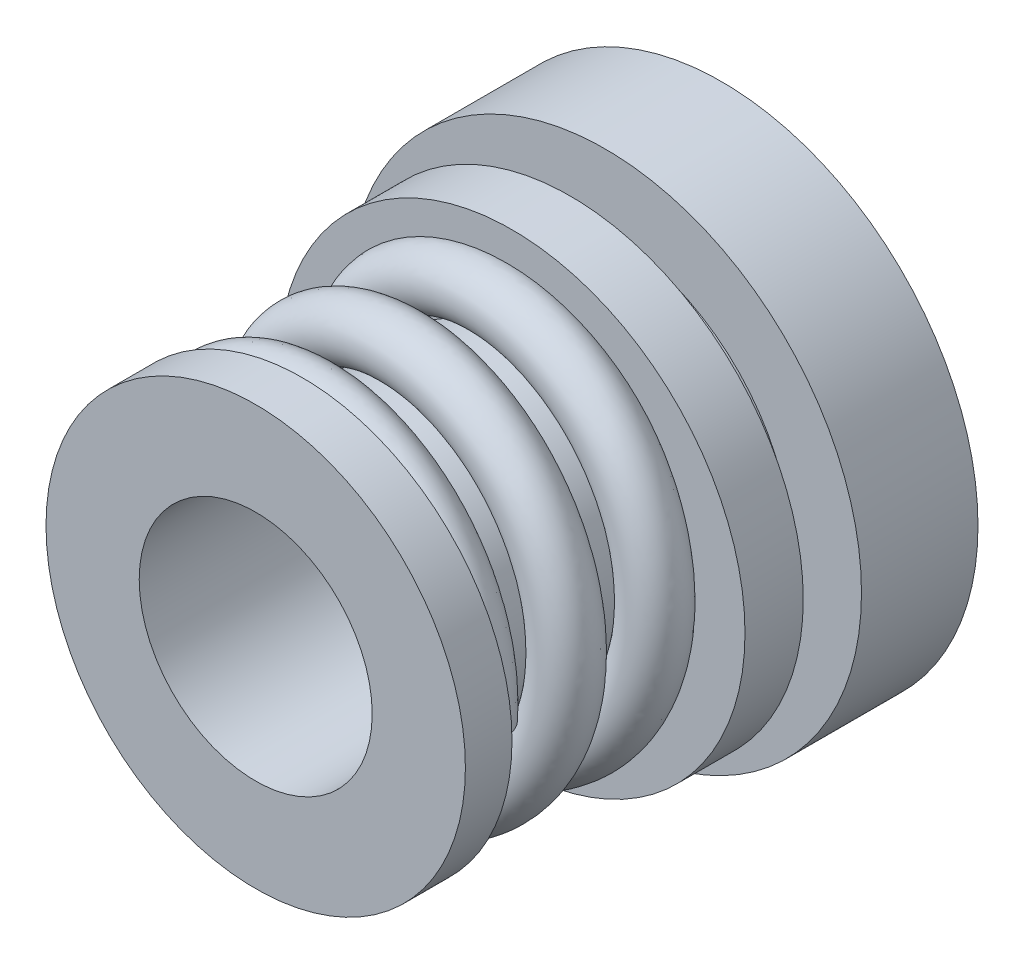
from build123d import *

# Parameters (mm, degrees)
BARRER1_PITCH = 3.8


with BuildPart() as part:
    # Croquis2 → Revolución1 (revolve)
    with BuildSketch(Plane(origin=(0, 0, 0), x_dir=(1, 0, 0), z_dir=(0, 1, 0)), mode=Mode.PRIVATE) as revoluci_n1_sk:
        with BuildLine():
            Line((-5, 18), (-11, 18))
            Line((-11, 18), (-11, 13))
            Line((-11, 13), (-8, 13))
            Line((-8, 13), (-8, 12))
            ThreePointArc((-8, 12), (-8.129065999, 11.663659399), (-8.45, 11.5))
            Line((-8.45, 11.5), (-10, 11.5))
            Line((-10, 11.5), (-10, 9))
            Line((-10, 9), (-6, 9))
            Line((-6, 9), (-6, 0))
            Line((-6, 0), (-9, 0))
            Line((-9, 0), (-9, -2))
            Line((-9, -2), (-5, -2))
            Line((-5, -2), (-5, 18))
        make_face()
    revolve(revoluci_n1_sk.sketch.rotate(Axis((0, 0, 0), (0, 0, -1)), 180), axis=Axis((0, 0, 0), (0, 0, -1)))

    # Barrer1: the profile of Croquis4 screwed along a left-hand helix of 2.5 turns, 12 arcs to a turn; built about Z, then put on its axis
    barrer1_z = Axis((0, 0, 0), (0, 0, 1))
    barrer1_corners = [(8.726092033, 0, 0), (7.5, 0, 1.226092033), (6.273907967, 0, 0), (7.5, 0, -1.226092033)]
    with BuildLine(mode=Mode.PRIVATE) as barrer1_profile:
        ThreePointArc((8.726092033, 0, 0), (8.366977991, 0, 0.866977991), (7.5, 0, 1.226092033))
        ThreePointArc((7.5, 0, 1.226092033), (6.633022009, 0, 0.866977991), (6.273907967, 0, 0))
        ThreePointArc((6.273907967, 0, 0), (6.633022009, 0, -0.866977991), (7.5, 0, -1.226092033))
        ThreePointArc((7.5, 0, -1.226092033), (8.366977991, 0, -0.866977991), (8.726092033, 0, 0))
    barrer1_cap = Face(barrer1_profile.wire())
    barrer1_arcs = [((8.726092033, 0, 0), (8.726092033, 0, 1.226092033), (7.5, 0, 1.226092033), (1, 0.7071067811865476, 1)), ((7.5, 0, 1.226092033), (6.273907967, 0, 1.226092033), (6.273907967, 0, 0), (1, 0.7071067811865476, 1)), ((6.273907967, 0, 0), (6.273907967, 0, -1.226092033), (7.5, 0, -1.226092033), (1, 0.7071067811865476, 1)), ((7.5, 0, -1.226092033), (8.726092033, 0, -1.226092033), (8.726092033, 0, 0), (1, 0.7071067811865476, 1))]  # start, shoulder, end, weights
    barrer1_turn_angles = [0, -15, -30, -45, -60, -75, -90, -105, -120, -135, -150, -165, -180, -195, -210, -225, -240, -255, -270, -285, -300, -315, -330, -345, -360]
    barrer1_turn_weights = [1, 0.9659258262890683, 1, 0.9659258262890683, 1, 0.9659258262890683, 1, 0.9659258262890683, 1, 0.9659258262890683, 1, 0.9659258262890683, 1, 0.9659258262890683, 1, 0.9659258262890683, 1, 0.9659258262890683, 1, 0.9659258262890683, 1, 0.9659258262890683, 1, 0.9659258262890683, 1]
    barrer1_turn_sides = [Face.make_bezier_surface([[Vector(p[j][0], p[j][1], 0).rotate(barrer1_z, barrer1_turn_angles[2 * i + k]) / barrer1_turn_weights[2 * i + k] + Vector(0, 0, p[j][2] + -BARRER1_PITCH * barrer1_turn_angles[2 * i + k] / 360) for k in range(3)] for j in range(3)], [[p[3][j] * barrer1_turn_weights[2 * i + k] for k in range(3)] for j in range(3)]) for p in barrer1_arcs for i in range(12)]
    barrer1_last_angles = [-720, -735, -750, -765, -780, -795, -810, -825, -840, -855, -870, -885, -900]
    barrer1_last_weights = [1, 0.9659258262890683, 1, 0.9659258262890683, 1, 0.9659258262890683, 1, 0.9659258262890683, 1, 0.9659258262890683, 1, 0.9659258262890629, 1]
    barrer1_last_sides = [Face.make_bezier_surface([[Vector(p[j][0], p[j][1], 0).rotate(barrer1_z, barrer1_last_angles[2 * i + k]) / barrer1_last_weights[2 * i + k] + Vector(0, 0, p[j][2] + -BARRER1_PITCH * barrer1_last_angles[2 * i + k] / 360) for k in range(3)] for j in range(3)], [[p[3][j] * barrer1_last_weights[2 * i + k] for k in range(3)] for j in range(3)]) for p in barrer1_arcs for i in range(6)]
    barrer1 = Plane(origin=(0, 0, 0), x_dir=(1, 0, 0), z_dir=(0, 0, -1)) * Solid(Shell([*[p.moved(Location((0, 0, BARRER1_PITCH * i))) for i in range(2) for p in barrer1_turn_sides], *barrer1_last_sides, barrer1_cap, barrer1_cap.rotate(barrer1_z, -900).moved(Location((0, 0, -BARRER1_PITCH * -900 / 360)))]))
    add(barrer1)


solid = part.part
